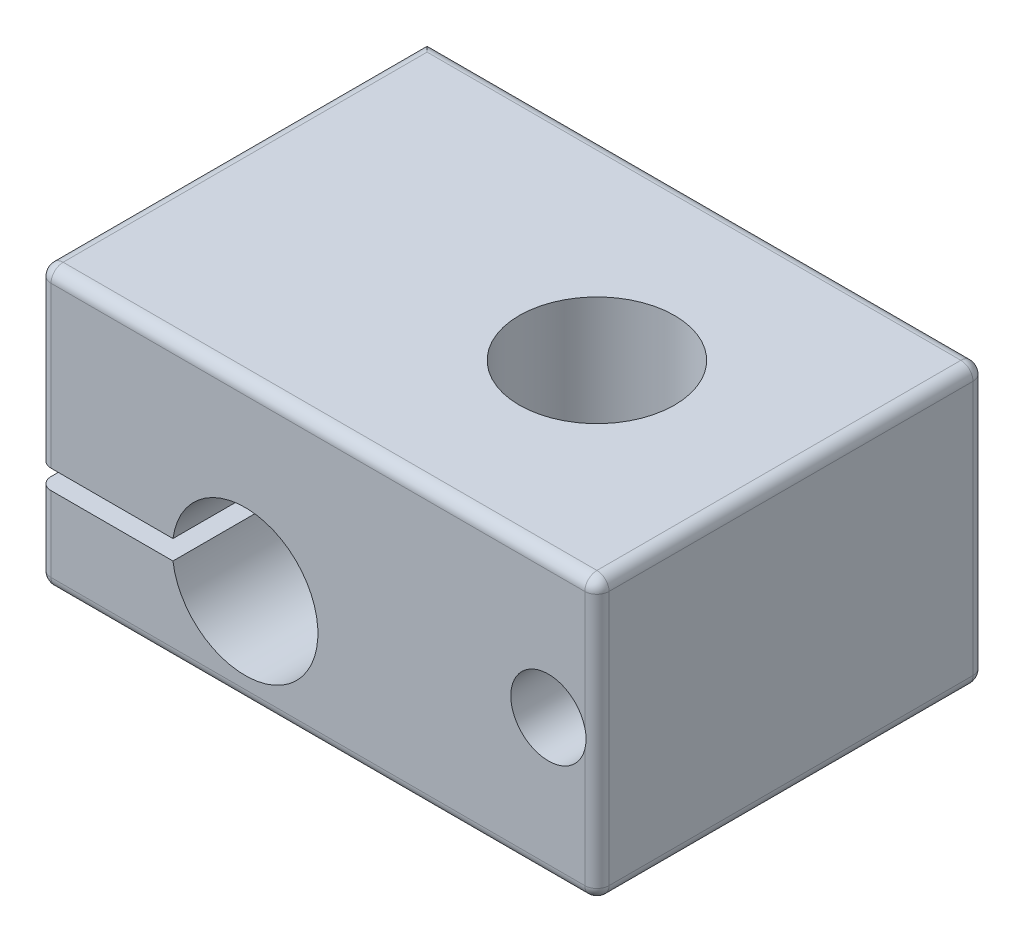
from build123d import *

# Parameters (mm, degrees)
SKETCH1_W                       = 23
SKETCH1_H                       = 16
BOSS_EXTRUDE1_DEPTH             = 11.5
SKETCH2_R                       = 1.55
CUT_EXTRUDE1_DEPTH              = 23.814469093
FILLET1_R                       = 0.5
M6_CLEARANCE_HOLE1_D            = 6.4
TAP_DRILL_FOR_M3X0_5_TAP1_D     = 2.5
TAP_DRILL_FOR_M3X0_5_TAP1_DEPTH = 4.399


with BuildPart() as part:
    # Sketch1 → Boss-Extrude1 (new body)
    with BuildSketch(Plane(origin=(0, 0, 0), x_dir=(1, 0, 0), z_dir=(0, 1, 0))):
        Rectangle(SKETCH1_W, SKETCH1_H)
    extrude(amount=BOSS_EXTRUDE1_DEPTH)

    # Sketch2 → Cut-Extrude1 (cut, through all)
    with BuildSketch(Plane.XY.offset(8)):
        with Locations((9.5, 5.75)):
            Circle(SKETCH2_R)
        with BuildLine():
            Line((-5.973213749, 4.4), (-11.5, 4.4))
            Line((-11.5, 4.4), (-11.5, 3.6))
            Line((-11.5, 3.6), (-5.973213749, 3.6))
            ThreePointArc((-5.973213749, 3.6), (0, 4), (-5.973213749, 4.4))
        make_face()
    extrude(amount=-CUT_EXTRUDE1_DEPTH, mode=Mode.SUBTRACT)

    # Fillet1
    # the kernel refuses this fillet: 0.5 mm, written as the material it takes off along each edge
    with BuildSketch(Plane(origin=(-11, 0.5, 7.5), x_dir=(0, -1, 0), z_dir=(0, 0, 1))) as fillet1_piece_1_section:
        Polygon((0, 0), (FILLET1_R * 1.02, 0), (FILLET1_R * 1.02, -FILLET1_R * 1.02), (0, -FILLET1_R * 1.02), align=None)
    fillet1_piece_1 = extrude(amount=FILLET1_R * 1.02, mode=Mode.PRIVATE)
    fillet1_piece_1 = fillet1_piece_1 - Plane(origin=(-11, 0.5, 7.5), x_dir=(0.7071067811865475, 0.7071067811865475, 0), z_dir=(0, 0, 1)) * Sphere(FILLET1_R, mode=Mode.PRIVATE)
    add(fillet1_piece_1, mode=Mode.SUBTRACT)
    with BuildSketch(Plane(origin=(-11, 11, 7.5), x_dir=(-1, 0, 0), z_dir=(0, 0, 1))) as fillet1_piece_2_section:
        Polygon((0, 0), (FILLET1_R * 1.02, 0), (FILLET1_R * 1.02, -FILLET1_R * 1.02), (0, -FILLET1_R * 1.02), align=None)
    fillet1_piece_2 = extrude(amount=FILLET1_R * 1.02, mode=Mode.PRIVATE)
    fillet1_piece_2 = fillet1_piece_2 - Plane(origin=(-11, 11, 7.5), x_dir=(0.7071067811865475, -0.7071067811865475, 0), z_dir=(0, 0, 1)) * Sphere(FILLET1_R, mode=Mode.PRIVATE)
    add(fillet1_piece_2, mode=Mode.SUBTRACT)
    with BuildSketch(Plane(origin=(11, 0.5, -7.5), x_dir=(0, -1, 0), z_dir=(1, 0, 0))) as fillet1_piece_3_section:
        Polygon((0, 0), (FILLET1_R * 1.02, 0), (FILLET1_R * 1.02, FILLET1_R * 1.02), (0, FILLET1_R * 1.02), align=None)
    fillet1_piece_3 = extrude(amount=FILLET1_R * 1.02, mode=Mode.PRIVATE)
    fillet1_piece_3 = fillet1_piece_3 - Plane(origin=(11, 0.5, -7.5), x_dir=(0, 0.7071067811865475, 0.7071067811865475), z_dir=(1, 0, 0)) * Sphere(FILLET1_R, mode=Mode.PRIVATE)
    add(fillet1_piece_3, mode=Mode.SUBTRACT)
    with BuildSketch(Plane(origin=(11, 11, -7.5), x_dir=(0, 0, -1), z_dir=(1, 0, 0))) as fillet1_piece_4_section:
        Polygon((0, 0), (FILLET1_R * 1.02, 0), (FILLET1_R * 1.02, FILLET1_R * 1.02), (0, FILLET1_R * 1.02), align=None)
    fillet1_piece_4 = extrude(amount=FILLET1_R * 1.02, mode=Mode.PRIVATE)
    fillet1_piece_4 = fillet1_piece_4 - Plane(origin=(11, 11, -7.5), x_dir=(0, -0.7071067811865475, 0.7071067811865475), z_dir=(1, 0, 0)) * Sphere(FILLET1_R, mode=Mode.PRIVATE)
    add(fillet1_piece_4, mode=Mode.SUBTRACT)
    with BuildSketch(Plane(origin=(-11, 0.5, -7.5), x_dir=(-1, 0, 0), z_dir=(0, -1, 0))) as fillet1_piece_5_section:
        Polygon((0, 0), (FILLET1_R * 1.02, 0), (FILLET1_R * 1.02, FILLET1_R * 1.02), (0, FILLET1_R * 1.02), align=None)
    fillet1_piece_5 = extrude(amount=FILLET1_R * 1.02, mode=Mode.PRIVATE)
    fillet1_piece_5 = fillet1_piece_5 - Plane(origin=(-11, 0.5, -7.5), x_dir=(0.7071067811865477, 0, 0.7071067811865474), z_dir=(0, -1, 0)) * Sphere(FILLET1_R, mode=Mode.PRIVATE)
    add(fillet1_piece_5, mode=Mode.SUBTRACT)
    with BuildSketch(Plane(origin=(11, 0.5, 7.5), x_dir=(1, 0, 0), z_dir=(0, 0, 1))) as fillet1_piece_6_section:
        Polygon((0, 0), (FILLET1_R * 1.02, 0), (FILLET1_R * 1.02, -FILLET1_R * 1.02), (0, -FILLET1_R * 1.02), align=None)
    fillet1_piece_6 = extrude(amount=FILLET1_R * 1.02, mode=Mode.PRIVATE)
    fillet1_piece_6 = fillet1_piece_6 - Plane(origin=(11, 0.5, 7.5), x_dir=(-0.7071067811865475, 0.7071067811865475, 1.4130832128153965e-15), z_dir=(0, 0, 1)) * Sphere(FILLET1_R, mode=Mode.PRIVATE)
    add(fillet1_piece_6, mode=Mode.SUBTRACT)
    with BuildSketch(Plane(origin=(11, 11, 7.5), x_dir=(1, 0, 0), z_dir=(0, 0, 1))) as fillet1_piece_7_section:
        Polygon((0, 0), (FILLET1_R * 1.02, 0), (FILLET1_R * 1.02, FILLET1_R * 1.02), (0, FILLET1_R * 1.02), align=None)
    fillet1_piece_7 = extrude(amount=FILLET1_R * 1.02, mode=Mode.PRIVATE)
    fillet1_piece_7 = fillet1_piece_7 - Plane(origin=(11, 11, 7.5), x_dir=(-0.7071067811865475, -0.7071067811865475, 1.4130832128153965e-15), z_dir=(0, 0, 1)) * Sphere(FILLET1_R, mode=Mode.PRIVATE)
    add(fillet1_piece_7, mode=Mode.SUBTRACT)
    with BuildSketch(Plane(origin=(-11.5, 0.5, 8), x_dir=(1, 0, 0), z_dir=(0, 1, 0))) as fillet1_piece_8:
        with BuildLine():
            CenterArc((FILLET1_R, FILLET1_R), FILLET1_R, 180, 90)
            Line((0, FILLET1_R), (0, 0))
            Line((0, 0), (FILLET1_R, 0))
        make_face()
    extrude(amount=4.35, mode=Mode.SUBTRACT)
    with BuildSketch(Plane(origin=(-11.5, 3.15, 8), x_dir=(1, 0, 0), z_dir=(0, 1, 0))) as fillet1_piece_9:
        with BuildLine():
            CenterArc((FILLET1_R, FILLET1_R), FILLET1_R, 180, 90)
            Line((0, FILLET1_R), (0, 0))
            Line((0, 0), (FILLET1_R, 0))
        make_face()
    extrude(amount=7.85, mode=Mode.SUBTRACT)
    with BuildSketch(Plane(origin=(11.5, 0.5, -8), x_dir=(0, 0, 1), z_dir=(0, 1, 0)), Plane(origin=(11.5, 0.5, 8), x_dir=(-1, 0, 0), z_dir=(0, 1, 0))) as fillet1_piece_10:
        with BuildLine():
            CenterArc((FILLET1_R, -FILLET1_R), FILLET1_R, 90, 90)
            Line((0, -FILLET1_R), (0, 0))
            Line((0, 0), (FILLET1_R, 0))
        make_face()
    extrude(amount=10.5, mode=Mode.SUBTRACT)
    with BuildSketch(Plane(origin=(-11.5, 0.5, -8), x_dir=(0, 0, 1), z_dir=(0, 1, 0))) as fillet1_piece_11_section:
        with BuildLine():
            CenterArc((FILLET1_R, FILLET1_R), FILLET1_R, 180, 90)
            Line((0, FILLET1_R), (0, 0))
            Line((0, 0), (FILLET1_R, 0))
        make_face()
    fillet1_piece_11 = extrude(amount=4.35, mode=Mode.PRIVATE)
    fillet1_piece_11 = split(fillet1_piece_11, bisect_by=Plane(origin=(-11.388316031, 4.4, -7.888316031), z_dir=(0, -1, 0)), keep=Keep.TOP, mode=Mode.PRIVATE)
    add(fillet1_piece_11, mode=Mode.SUBTRACT)
    with BuildSketch(Plane(origin=(11.5, 0, -7.5), x_dir=(-1, 0, 0), z_dir=(0, 0, 1)), Plane(origin=(-11.5, 0, 7.5), x_dir=(1, 0, 0), z_dir=(0, 0, -1))) as fillet1_piece_12:
        with BuildLine():
            CenterArc((FILLET1_R, -FILLET1_R), FILLET1_R, 90, 90)
            Line((0, -FILLET1_R), (0, 0))
            Line((0, 0), (FILLET1_R, 0))
        make_face()
    extrude(amount=15, mode=Mode.SUBTRACT)
    with BuildSketch(Plane(origin=(-11, 0, -8), x_dir=(0, 0, 1), z_dir=(1, 0, 0)), Plane(origin=(11, 11.5, 8), x_dir=(0, -1, 0), z_dir=(-1, 0, 0))) as fillet1_piece_13:
        with BuildLine():
            CenterArc((FILLET1_R, -FILLET1_R), FILLET1_R, 90, 90)
            Line((0, -FILLET1_R), (0, 0))
            Line((0, 0), (FILLET1_R, 0))
        make_face()
    extrude(amount=22, mode=Mode.SUBTRACT)
    with BuildSketch(Plane(origin=(11, 0, 8), x_dir=(0, 1, 0), z_dir=(-1, 0, 0))) as fillet1_piece_14:
        with BuildLine():
            CenterArc((FILLET1_R, FILLET1_R), FILLET1_R, 180, 90)
            Line((0, FILLET1_R), (0, 0))
            Line((0, 0), (FILLET1_R, 0))
        make_face()
    extrude(amount=22, mode=Mode.SUBTRACT)
    with BuildSketch(Plane(origin=(-12.75, 11.5, -8), x_dir=(0, 0, 1), z_dir=(1, 0, 0))) as fillet1_piece_15:
        with BuildLine():
            CenterArc((FILLET1_R, FILLET1_R), FILLET1_R, 180, 90)
            Line((0, FILLET1_R), (0, 0))
            Line((0, 0), (FILLET1_R, 0))
        make_face()
    extrude(amount=23.75, mode=Mode.SUBTRACT)
    with BuildSketch(Plane(origin=(11.5, 11.5, -7.5), x_dir=(-1, 0, 0), z_dir=(0, 0, 1))) as fillet1_piece_16:
        with BuildLine():
            CenterArc((FILLET1_R, FILLET1_R), FILLET1_R, 180, 90)
            Line((0, FILLET1_R), (0, 0))
            Line((0, 0), (FILLET1_R, 0))
        make_face()
    extrude(amount=15, mode=Mode.SUBTRACT)
    with BuildSketch(Plane(origin=(-11.5, 11.5, 7.5), x_dir=(0, -1, 0), z_dir=(0, 0, -1))) as fillet1_piece_17:
        with BuildLine():
            CenterArc((FILLET1_R, -FILLET1_R), FILLET1_R, 90, 90)
            Line((0, -FILLET1_R), (0, 0))
            Line((0, 0), (FILLET1_R, 0))
        make_face()
    extrude(amount=16.75, mode=Mode.SUBTRACT)

    # M6 Clearance Hole1 (through all)
    with Locations(Plane(origin=(0, 0, 0), x_dir=(-1, 0, 0), z_dir=(0, -1, 0))):
        with Locations((-3.5, 0)):
            Hole(M6_CLEARANCE_HOLE1_D / 2)

    # Tap Drill for M3x0.5 Tap1
    with Locations(Plane(origin=(0, 0, 0), x_dir=(-1, 0, 0), z_dir=(0, -1, 0))):
        with Locations((9, 0)):
            Hole(TAP_DRILL_FOR_M3X0_5_TAP1_D / 2, depth=TAP_DRILL_FOR_M3X0_5_TAP1_DEPTH)


solid = part.part
